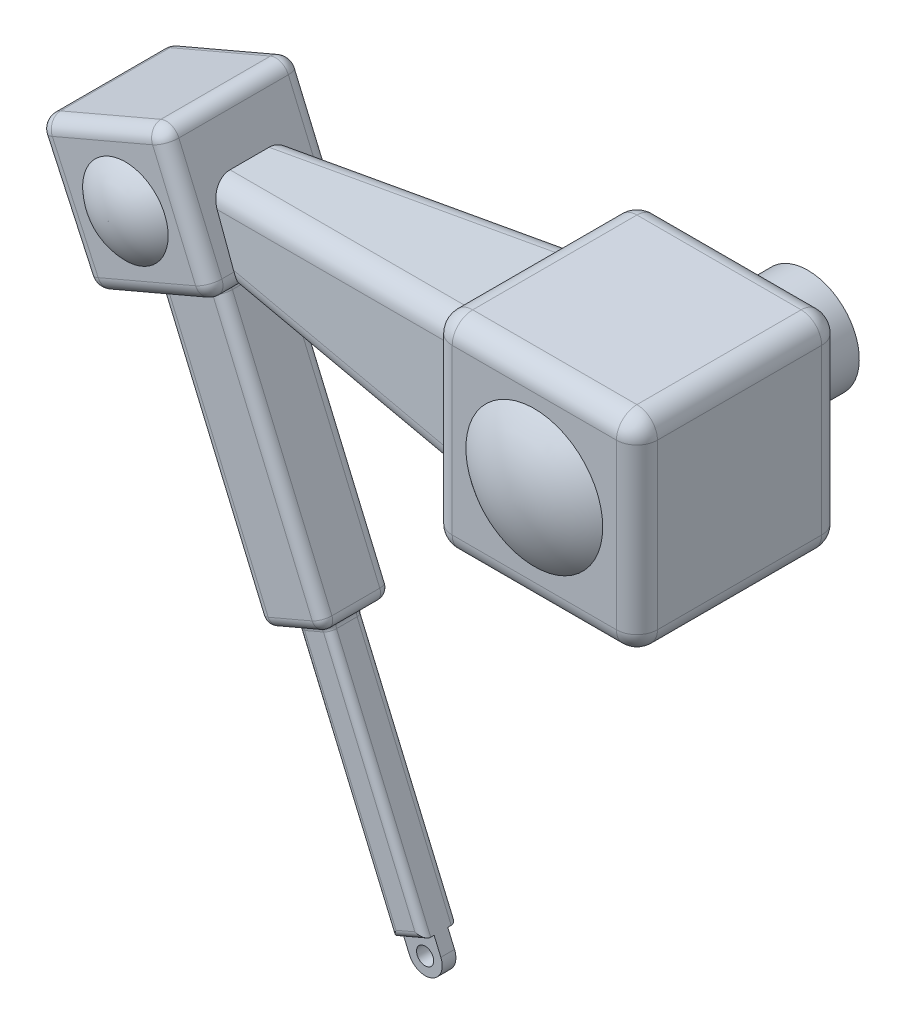
from build123d import *

# Parameters (mm, degrees)
BOSS_EXTRUDE3_DEPTH  = 50
BOSS_EXTRUDE4_DEPTH  = 50
BOSS_EXTRUDE5_DEPTH  = 150
BOSS_EXTRUDE6_DEPTH  = 150
BOSS_EXTRUDE7_DEPTH  = 100
BOSS_EXTRUDE8_DEPTH  = 100
SKETCH4_R            = 75.00000000000001
BOSS_EXTRUDE9_DEPTH  = 100
BOSS_EXTRUDE12_DEPTH = 50
BOSS_EXTRUDE13_DEPTH = 50
BOSS_EXTRUDE16_DEPTH = 25
BOSS_EXTRUDE17_DEPTH = 25
BOSS_EXTRUDE18_DEPTH = 10
BOSS_EXTRUDE19_START = -10
BOSS_EXTRUDE19_DEPTH = 10
FILLET2_R            = 10
FILLET4_R            = 15
FILLET5_R            = 20
FILLET6_R            = 30
FILLET7_R            = 30
SKETCH5_R            = 62.500000000000014
BOSS_EXTRUDE20_DEPTH = 25
FILLET8_R            = 90
SKETCH6_R            = 100
BOSS_EXTRUDE21_DEPTH = 35
FILLET9_R            = 160


with BuildPart() as part:
    # Sketch2 → Boss-Extrude3 (new body)
    with BuildSketch(Plane.XY):
        Polygon((-519.8794078050754, -50), (-150, -49.999999999999986), (-149.99999999999997, 50), (-562.6193238983217, 50), align=None)
        Polygon((-650, -50.00000000000001), (-519.8794078050754, -50), (-562.6193238983217, 50), (-650, 49.99999999999999), align=None)
    extrude(amount=BOSS_EXTRUDE3_DEPTH)

    # Sketch2<5> → Boss-Extrude4 (add)
    with BuildSketch(Plane.XY):
        Polygon((-519.8794078050754, -50), (-150, -49.999999999999986), (-149.99999999999997, 50), (-562.6193238983217, 50), align=None)
        Polygon((-650, -50.00000000000001), (-519.8794078050754, -50), (-562.6193238983217, 50), (-650, 49.99999999999999), align=None)
    extrude(amount=-BOSS_EXTRUDE4_DEPTH)

    # Draft2: read off the stored shape, not the designer's step
    # Draft2: loft between two sections, ruled curve by curve
    draft2_from = [
        Edge.make_line((-150, 100, 100), (-150, 100, -100)),
        Edge.make_line((-150, -100, -100), (-150, -100, 100)),
        Edge.make_line((-150, 100, 100), (-150, -100, 100)),
        Edge.make_line((-150, 100, -100), (-150, -100, -100)),
    ]
    draft2_to = [
        Edge.make_line((-650, 50, 50), (-650, 50, -50)),
        Edge.make_line((-650, -50, -50), (-650, -50, 50)),
        Edge.make_line((-650, 50, 50), (-650, -50, 50)),
        Edge.make_line((-650, 50, -50), (-650, -50, -50)),
    ]
    draft2 = Solid(Shell([*[Face.make_surface_from_curves(draft2_from[k], draft2_to[k]) for k in range(4)], Face(Wire(draft2_from)), Face(Wire(draft2_to))]))
    add(draft2)

    # Sketch2<6> → Boss-Extrude5 (add)
    with BuildSketch(Plane.XY):
        Polygon((-150, -150), (-149.99999999999997, 150), (149.99999999999997, 150.00000000000003), (150, -149.99999999999997), align=None)
    extrude(amount=BOSS_EXTRUDE5_DEPTH)

    # Sketch2<7> → Boss-Extrude6 (add)
    with BuildSketch(Plane.XY):
        Polygon((-150, -150), (-149.99999999999997, 150), (149.99999999999997, 150.00000000000003), (150, -149.99999999999997), align=None)
    extrude(amount=-BOSS_EXTRUDE6_DEPTH)

    # Sketch2<8> → Boss-Extrude7 (add)
    with BuildSketch(Plane.XY):
        Polygon((-518.7456701184896, -52.65264368819146), (-519.8794078050754, -49.99999999999999), (-650, -50.00000000000001), (-650, 49.99999999999999), (-562.6193238983217, 50), (-597.3157590953267, 131.18040082555925), (-781.2227326650285, 52.57871463224018), (-697.4385596485628, -129.02583473794203), (-654.0688582759504, -110.48966076139602), (-562.1153714910995, -71.18881766473643), align=None)
        Polygon((-650, -50.00000000000001), (-519.8794078050754, -50), (-562.6193238983217, 50), (-650, 49.99999999999999), align=None)
    extrude(amount=BOSS_EXTRUDE7_DEPTH)

    # Sketch2<9> → Boss-Extrude8 (add)
    with BuildSketch(Plane.XY):
        Polygon((-518.7456701184896, -52.65264368819146), (-519.8794078050754, -49.99999999999999), (-650, -50.00000000000001), (-650, 49.99999999999999), (-562.6193238983217, 50), (-597.3157590953267, 131.18040082555925), (-781.2227326650285, 52.57871463224018), (-697.4385596485628, -129.02583473794203), (-654.0688582759504, -110.48966076139602), (-562.1153714910995, -71.18881766473643), align=None)
        Polygon((-650, -50.00000000000001), (-519.8794078050754, -50), (-562.6193238983217, 50), (-650, 49.99999999999999), align=None)
    extrude(amount=-BOSS_EXTRUDE8_DEPTH)

    # Sketch4 → Boss-Extrude9 (add)
    with BuildSketch(Plane(origin=(0, 1.04744e-12, -149.99999999999983), x_dir=(-1, 0, 0), z_dir=(0, 6.98e-15, -1))):
        with Locations(Location((0, 0, 0), (0, 0, 90))):
            Circle(SKETCH4_R)
    extrude(amount=BOSS_EXTRUDE9_DEPTH)

    # Sketch2<10> → Boss-Extrude12 (add)
    with BuildSketch(Plane.XY):
        Polygon((-404.91199910446187, -439.00276480414016), (-562.1153714910995, -71.1888176647364), (-654.0688582759504, -110.48966076139602), (-496.8654858893127, -478.3036079007997), (-473.8771141930994, -468.47839712663455), (-427.900370800674, -448.8279755783048), align=None)
    extrude(amount=BOSS_EXTRUDE12_DEPTH)

    # Sketch2<11> → Boss-Extrude13 (add)
    with BuildSketch(Plane.XY):
        Polygon((-404.91199910446187, -439.00276480414016), (-562.1153714910995, -71.1888176647364), (-654.0688582759504, -110.48966076139602), (-496.8654858893127, -478.3036079007997), (-473.8771141930994, -468.47839712663455), (-427.900370800674, -448.8279755783048), align=None)
    extrude(amount=-BOSS_EXTRUDE13_DEPTH)

    # Sketch2<16> → Boss-Extrude16 (add)
    with BuildSketch(Plane.XY):
        Polygon((-286.4173356526999, -779.8605280037665), (-427.90037080067407, -448.8279755783047), (-473.8771141930994, -468.47839712663455), (-332.3940790451254, -799.5109495520962), (-309.4057065781073, -789.6857384484898), align=None)
    extrude(amount=BOSS_EXTRUDE16_DEPTH)

    # Sketch2<17> → Boss-Extrude17 (add)
    with BuildSketch(Plane.XY):
        Polygon((-286.4173356526999, -779.8605280037665), (-427.90037080067407, -448.8279755783047), (-473.8771141930994, -468.47839712663455), (-332.3940790451254, -799.5109495520962), (-309.4057065781073, -789.6857384484898), align=None)
    extrude(amount=-BOSS_EXTRUDE17_DEPTH)

    # Sketch2<18> → Boss-Extrude18 (add)
    with BuildSketch(Plane.XY):
        with BuildLine():
            ThreePointArc((-274.58049657474714, -812.6741104741453), (-275.0885663485959, -807.6595961609399), (-276.59212487853443, -802.8488996999804))
            Line((-276.59212487853443, -802.8488996999804), (-288.0863107266407, -807.7615050870628))
            ThreePointArc((-288.086310726641, -807.7615050870623), (-287.3345314616716, -810.1668533175424), (-287.08049657474714, -812.6741104741453))
            ThreePointArc((-287.08049657474714, -812.6741104741453), (-297.07323941814474, -824.9200755872209), (-311.0746824228537, -817.5867158612273))
            Line((-311.07468242285347, -817.5867158612277), (-322.5688682709599, -822.4993212483103))
            ThreePointArc((-322.56886827095985, -822.4993212483103), (-294.5659822615418, -837.1660407002965), (-274.58049657474714, -812.6741104741453))
        make_face()
        with BuildLine():
            Line((-288.0863107266407, -807.7615050870628), (-276.59212487853443, -802.8488996999804))
            ThreePointArc((-276.59212487853443, -802.8488996999804), (-290.27273583592137, -789.471403950363), (-309.40570657810673, -789.6857384484911))
            ThreePointArc((-309.40570657810673, -789.6857384484911), (-322.78320309852955, -803.3663497353195), (-322.56886827095985, -822.4993212483103))
            Line((-322.5688682709599, -822.4993212483103), (-311.07468242285347, -817.5867158612277))
            ThreePointArc((-311.0746824228537, -817.5867158612273), (-304.4931019618296, -801.179924626039), (-288.086310726641, -807.7615050870623))
        make_face()
        with BuildLine():
            Line((-309.4057065781073, -789.6857384484898), (-332.39407904512547, -799.5109495520962))
            Line((-332.3940790451254, -799.5109495520962), (-322.5688682709599, -822.4993212483103))
            ThreePointArc((-322.56886827095985, -822.4993212483103), (-322.78320309852955, -803.3663497353195), (-309.40570657810673, -789.6857384484911))
        make_face()
        with BuildLine():
            Line((-276.59212487853443, -802.8488996999804), (-286.4173356526999, -779.8605280037665))
            Line((-286.4173356526999, -779.8605280037665), (-309.4057065781073, -789.6857384484898))
            ThreePointArc((-309.40570657810673, -789.6857384484911), (-290.27273583592137, -789.471403950363), (-276.59212487853443, -802.8488996999804))
        make_face()
        with BuildLine():
            ThreePointArc((-274.58049657474714, -812.6741104741453), (-275.0885663485959, -807.6595961609399), (-276.59212487853443, -802.8488996999804))
            Line((-276.59212487853443, -802.8488996999804), (-288.0863107266407, -807.7615050870628))
            ThreePointArc((-288.086310726641, -807.7615050870623), (-287.3345314616716, -810.1668533175424), (-287.08049657474714, -812.6741104741453))
            ThreePointArc((-287.08049657474714, -812.6741104741453), (-297.07323941814474, -824.9200755872209), (-311.0746824228537, -817.5867158612273))
            Line((-311.07468242285347, -817.5867158612277), (-322.5688682709599, -822.4993212483103))
            ThreePointArc((-322.56886827095985, -822.4993212483103), (-294.5659822615418, -837.1660407002965), (-274.58049657474714, -812.6741104741453))
        make_face()
        with BuildLine():
            Line((-288.0863107266407, -807.7615050870628), (-276.59212487853443, -802.8488996999804))
            ThreePointArc((-276.59212487853443, -802.8488996999804), (-290.27273583592137, -789.471403950363), (-309.40570657810673, -789.6857384484911))
            ThreePointArc((-309.40570657810673, -789.6857384484911), (-322.78320309852955, -803.3663497353195), (-322.56886827095985, -822.4993212483103))
            Line((-322.5688682709599, -822.4993212483103), (-311.07468242285347, -817.5867158612277))
            ThreePointArc((-311.0746824228537, -817.5867158612273), (-304.4931019618296, -801.179924626039), (-288.086310726641, -807.7615050870623))
        make_face()
    extrude(amount=BOSS_EXTRUDE18_DEPTH)

    # Sketch2<20> → Boss-Extrude19 (add)
    with BuildSketch(Plane.XY.offset(BOSS_EXTRUDE19_START)):
        with BuildLine():
            Line((-309.4057065781073, -789.6857384484898), (-332.39407904512547, -799.5109495520962))
            Line((-332.3940790451254, -799.5109495520962), (-322.5688682709599, -822.4993212483103))
            ThreePointArc((-322.56886827095985, -822.4993212483103), (-322.78320309852955, -803.3663497353195), (-309.40570657810673, -789.6857384484911))
        make_face()
        with BuildLine():
            ThreePointArc((-274.58049657474714, -812.6741104741453), (-275.0885663485959, -807.6595961609399), (-276.59212487853443, -802.8488996999804))
            Line((-276.59212487853443, -802.8488996999804), (-288.0863107266407, -807.7615050870628))
            ThreePointArc((-288.086310726641, -807.7615050870623), (-287.3345314616716, -810.1668533175424), (-287.08049657474714, -812.6741104741453))
            ThreePointArc((-287.08049657474714, -812.6741104741453), (-297.07323941814474, -824.9200755872209), (-311.0746824228537, -817.5867158612273))
            Line((-311.07468242285347, -817.5867158612277), (-322.5688682709599, -822.4993212483103))
            ThreePointArc((-322.56886827095985, -822.4993212483103), (-294.5659822615418, -837.1660407002965), (-274.58049657474714, -812.6741104741453))
        make_face()
        with BuildLine():
            Line((-288.0863107266407, -807.7615050870628), (-276.59212487853443, -802.8488996999804))
            ThreePointArc((-276.59212487853443, -802.8488996999804), (-290.27273583592137, -789.471403950363), (-309.40570657810673, -789.6857384484911))
            ThreePointArc((-309.40570657810673, -789.6857384484911), (-322.78320309852955, -803.3663497353195), (-322.56886827095985, -822.4993212483103))
            Line((-322.5688682709599, -822.4993212483103), (-311.07468242285347, -817.5867158612277))
            ThreePointArc((-311.0746824228537, -817.5867158612273), (-304.4931019618296, -801.179924626039), (-288.086310726641, -807.7615050870623))
        make_face()
        with BuildLine():
            ThreePointArc((-274.58049657474714, -812.6741104741453), (-275.0885663485959, -807.6595961609399), (-276.59212487853443, -802.8488996999804))
            Line((-276.59212487853443, -802.8488996999804), (-288.0863107266407, -807.7615050870628))
            ThreePointArc((-288.086310726641, -807.7615050870623), (-287.3345314616716, -810.1668533175424), (-287.08049657474714, -812.6741104741453))
            ThreePointArc((-287.08049657474714, -812.6741104741453), (-297.07323941814474, -824.9200755872209), (-311.0746824228537, -817.5867158612273))
            Line((-311.07468242285347, -817.5867158612277), (-322.5688682709599, -822.4993212483103))
            ThreePointArc((-322.56886827095985, -822.4993212483103), (-294.5659822615418, -837.1660407002965), (-274.58049657474714, -812.6741104741453))
        make_face()
        with BuildLine():
            Line((-288.0863107266407, -807.7615050870628), (-276.59212487853443, -802.8488996999804))
            ThreePointArc((-276.59212487853443, -802.8488996999804), (-290.27273583592137, -789.471403950363), (-309.40570657810673, -789.6857384484911))
            ThreePointArc((-309.40570657810673, -789.6857384484911), (-322.78320309852955, -803.3663497353195), (-322.56886827095985, -822.4993212483103))
            Line((-322.5688682709599, -822.4993212483103), (-311.07468242285347, -817.5867158612277))
            ThreePointArc((-311.0746824228537, -817.5867158612273), (-304.4931019618296, -801.179924626039), (-288.086310726641, -807.7615050870623))
        make_face()
        with BuildLine():
            Line((-276.59212487853443, -802.8488996999804), (-286.4173356526999, -779.8605280037665))
            Line((-286.4173356526999, -779.8605280037665), (-309.4057065781073, -789.6857384484898))
            ThreePointArc((-309.40570657810673, -789.6857384484911), (-290.27273583592137, -789.471403950363), (-276.59212487853443, -802.8488996999804))
        make_face()
    extrude(amount=BOSS_EXTRUDE19_DEPTH)

    # Fillet2
    fillet2_edges = [part.edges().sort_by_distance(p)[0] for p in [
        (-309.40570734891264, -789.6857387779314, 25),
        (-357.158853226687, -614.3442517910356, 25),
        (-427.90037080067407, -448.82797557830474, 0),
        (-403.1355966191124, -633.9946733393654, 25),
        (-473.8771141930994, -468.4783971266345, 0),
        (-450.8887424968867, -458.6531863524697, 25),
        (-450.8887424968867, -458.6531863524697, -25),
        (-309.40570734891264, -789.6857387779314, -25),
        (-403.1355966191124, -633.9946733393654, -25),
        (-357.158853226687, -614.3442517910356, -25),
    ]]
    fillet(fillet2_edges, radius=FILLET2_R)

    # Fillet4
    fillet4_edges = [part.edges().sort_by_distance(p)[0] for p in [
        (-483.5136852977807, -255.09579123443828, 50),
        (-404.91199910446187, -439.00276480414016, 0),
        (-608.092114883525, -90.83923921306624, 50),
        (-562.1153714910995, -71.18881766473642, 0),
        (-575.4671720826316, -294.39663433109786, 50),
        (-654.0688582759504, -110.48966076139598, 0),
        (-450.8887424968873, -458.6531863524699, 50),
        (-496.8654858893127, -478.3036079007997, 0),
        (-483.5136852977807, -255.09579123443828, -50),
        (-450.8887424968873, -458.6531863524699, -50),
        (-575.4671720826316, -294.39663433109786, -50),
        (-608.092114883525, -90.83923921306624, -50),
    ]]
    fillet(fillet4_edges, radius=FILLET4_R - 0.0001)  # a hair under: the kernel refuses the full size

    # Fillet5
    fillet5_edges = [part.edges().sort_by_distance(p)[0] for p in [
        (-697.4385596485628, -129.02583473794203, 0),
        (-518.7456701184896, -52.65264368819146, 81.56271649407552),
        (-597.3157590953267, 131.18040082555925, 0),
        (-781.2227326650285, 52.57871463224018, 0),
        (-558.0307146069081, 39.26387856868389, 100),
        (-689.2692458801776, 91.8795577288997, 100),
        (-739.3306461567956, -38.22356005285092, 100),
        (-608.0921148835262, -90.83923921306675, 100),
        (-608.0921148835262, -90.83923921306675, -100),
        (-518.7456701184896, -52.65264368819146, -81.56271649407552),
        (-558.0307146069081, 39.26387856868389, -100),
        (-739.3306461567956, -38.22356005285092, -100),
        (-689.2692458801776, 91.8795577288997, -100),
    ]]
    fillet(fillet5_edges, radius=FILLET5_R)

    # Fillet6
    fillet6_edges = [part.edges().sort_by_distance(p)[0] for p in [
        (-358.1004453972281, 79.18995546027719, 79.18995546027719),
        (-344.3015475750585, -80.56984524249415, 80.56984524249415),
        (-344.3015475750585, -80.56984524249415, -80.56984524249415),
        (-358.1004453972281, 79.18995546027719, -79.18995546027719),
    ]]
    fillet(fillet6_edges, radius=FILLET6_R)

    # Fillet7
    fillet7_edges = [part.edges().sort_by_distance(p)[0] for p in [
        (-150, 0, 150),
        (-149.99999999999997, 150, 0),
        (0, -150, 150),
        (-150, -150, 0),
        (150, -149.99999999999997, 0),
        (149.99999999999997, 150.00000000000003, 0),
        (150, 2.842e-14, 150),
        (0, 150, 150),
        (0, 150, -150),
        (150, 2.842e-14, -150),
        (-150, 0, -150),
        (0, -150, -150),
    ]]
    fillet(fillet7_edges, radius=FILLET7_R)

    # Sketch5 → Boss-Extrude20 (add)
    with BuildSketch(Plane.XY.offset(100.00000000000023)):
        with Locations((-647.6342704776299, 0.9673939729716794)):
            Circle(SKETCH5_R)
    extrude(amount=BOSS_EXTRUDE20_DEPTH)

    # Fillet8
    # the kernel refuses this fillet: 90 mm, written as the material it takes off along each edge
    with BuildSketch(Plane(origin=(-647.6342704776299, 0.9673939729723777, 125.00000000000023), x_dir=(1, 0, 0), z_dir=(0, -1, 0))) as fillet8_piece_1:
        with BuildLine():
            CenterArc((0.25050201005626604, -90), FILLET8_R, 46.23825730732015, 43.76174269267985)
            Line((0.25050201005626604, 0), (0.25050201005626604, 1.7999999999999972))
            Line((0.25050201005626604, 1.7999999999999972), (62.5, 1.7999999999999972))
            Line((62.5, 1.7999999999999972), (64.29999999999995, 0))
            ThreePointArc((64.29999999999995, 0), (64.29999999999995, -12.500000000000028), (63.744989959798886, -23.700000000000045))
            Line((63.744989959798886, -23.700000000000045), (62.5, -25.000000000000043))
        make_face()
    revolve(axis=Axis((-647.6342704776299, 0.9673939729723777, 125.00000000000023), (0, 0, 1)), mode=Mode.SUBTRACT)

    # Sketch6 → Boss-Extrude21 (add)
    with BuildSketch(Plane.XY.offset(149.99999999999957)):
        Circle(SKETCH6_R)
    extrude(amount=BOSS_EXTRUDE21_DEPTH)

    # Fillet9
    # the kernel refuses this fillet: 160 mm, written as the material it takes off along each edge
    with BuildSketch(Plane(origin=(0, 0, 184.99999999999957), x_dir=(1, 0, 0), z_dir=(0, -1, 0))) as fillet9_piece_1:
        with BuildLine():
            CenterArc((0.12507822281143957, -160), FILLET9_R, 51.375167126947694, 38.624832873052306)
            Line((0.12507822281143957, 0), (0.12507822281143957, 3.1999999999999886))
            Line((0.12507822281143957, 3.1999999999999886), (100, 3.1999999999999886))
            Line((100, 3.1999999999999886), (103.2, 0))
            ThreePointArc((103.2, 0), (103.2, -17.49999999999943), (101.9974984355447, -32.499999999998835))
            Line((101.9974984355447, -32.499999999998835), (100.00000000000091, -34.99999999999886))
        make_face()
    revolve(axis=Axis((0, 0, 184.99999999999957), (0, 0, 1)), mode=Mode.SUBTRACT)


solid = part.part
